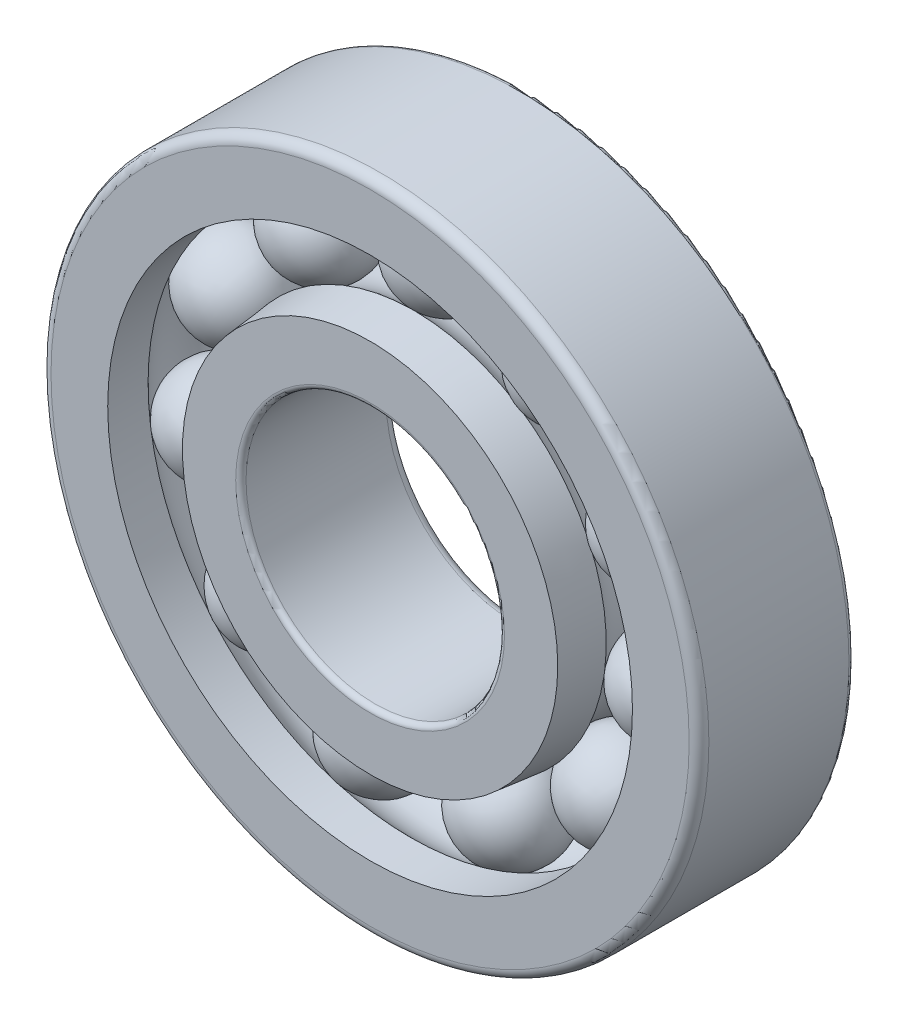
from build123d import *

# Parameters (mm, degrees)
FILLET1_R            = 2.1
FILLET2_R            = 1.1
CIRPATTERNBALL_COUNT = 11


with BuildPart() as part:
    # BaseSke → Ball (revolve)
    with BuildSketch(Plane(origin=(0, 0, 0), x_dir=(0, 0, -1), z_dir=(1, 0, 0))):
        with BuildLine():
            Line((0, 59.375), (0, 38.125))
            ThreePointArc((0, 38.125), (-10.625, 48.75), (0, 59.375))
        make_face()
    ball = revolve(axis=Axis((0, 59.375, 0), (0, -1, 0)))

    # OuterRaceSke → OuterRace (revolve)
    with BuildSketch(Plane(origin=(0, 0, 0), x_dir=(0, 0, -1), z_dir=(1, 0, 0))):
        with BuildLine():
            Line((-16.5, 70), (16.5, 70))
            Line((16.5, 70), (16.5, 57.567553215))
            Line((16.5, 57.567553215), (7.160727396, 56.58595611))
            ThreePointArc((7.160727396, 56.58595611), (-0.529587425, 59.351781084), (-7.905985953, 55.833333333))
            Line((-7.905985953, 55.833333333), (-16.5, 55.833333333))
            Line((-16.5, 55.833333333), (-16.5, 70))
        make_face()
    revolve(axis=Axis((0, 0, 50.391616343), (0, 0, -1)))

    # InnerRaceSke → InnerRace (revolve)
    with BuildSketch(Plane(origin=(0, 0, 0), x_dir=(0, 0, -1), z_dir=(1, 0, 0))):
        with BuildLine():
            Line((-16.5, 27.5), (16.5, 27.5))
            Line((16.5, 27.5), (16.5, 41.666666667))
            Line((16.5, 41.666666667), (7.905985953, 41.666666667))
            ThreePointArc((7.905985953, 41.666666667), (0, 38.135), (-7.905985953, 41.666666667))
            Line((-7.905985953, 41.666666667), (-16.5, 41.666666667))
            Line((-16.5, 41.666666667), (-16.5, 27.5))
        make_face()
    revolve(axis=Axis((0, 0, 70.862590906), (0, 0, -1)))

    # Fillet1
    fillet1_edges = [part.edges().sort_by_distance(p)[0] for p in [
        (0, -27.5, -16.5),
        (0, -70, 16.5),
    ]]
    fillet(fillet1_edges, radius=FILLET1_R)

    # Fillet2
    fillet2_edges = [part.edges().sort_by_distance(p)[0] for p in [
        (0, -70, -16.5),
        (0, -27.5, 16.5),
    ]]
    fillet(fillet2_edges, radius=FILLET2_R)

    # CutInnerRaceSke → CutInnerRace (revolve, cut)
    with BuildSketch(Plane(origin=(0, 0, 0), x_dir=(0, 0, -1), z_dir=(1, 0, 0))):
        with BuildLine():
            Line((-7.905985953, 41.666666667), (-16.5, 41.666666667))
            Line((-16.5, 41.666666667), (-16.5, 39.932446785))
            Line((-16.5, 39.932446785), (-7.160727396, 40.91404389))
            ThreePointArc((-7.160727396, 40.91404389), (-7.542749701, 41.28105416), (-7.905985953, 41.666666667))
        make_face()
    revolve(axis=Axis((0, 0, 28.306583022), (0, 0, -1)), mode=Mode.SUBTRACT)

    # CirPatternBall: Ball ×11 about axis
    cirpatternball_axis = Axis((0, 0, 50.391616343), (0, 0, -1))
    for i in range(1, CIRPATTERNBALL_COUNT):
        add(ball.rotate(cirpatternball_axis, i * 360 / CIRPATTERNBALL_COUNT))


solid = part.part
